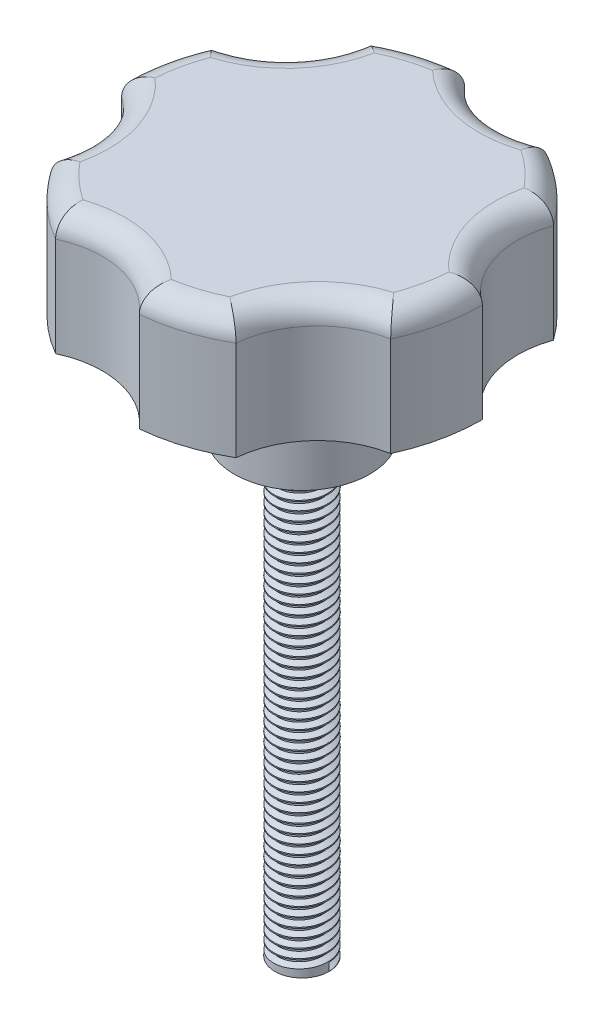
from build123d import *

# Parameters (mm, degrees)
SKETCH1_R           = 20
BOSS_EXTRUDE1_DEPTH = 13.5
CUT_EXTRUDE1_START  = -13.5
CUT_EXTRUDE1_DEPTH  = 13.5
CIRPATTERN1_COUNT   = 6
FILLET1_R           = 2.5
SKETCH4_R           = 7.5
BOSS_EXTRUDE2_DEPTH = 11.5
SKETCH5_R           = 3
BOSS_EXTRUDE3_DEPTH = 50
THREAD1_PITCH       = 1


with BuildPart() as part:
    # Sketch1 → Boss-Extrude1 (new body)
    with BuildSketch(Plane(origin=(0, 0, 0), x_dir=(1, 0, 0), z_dir=(0, 1, 0))):
        with Locations(Location((0, 0, 0), (0, 0, 270))):
            Circle(SKETCH1_R)
    extrude(amount=BOSS_EXTRUDE1_DEPTH)

    # Sketch2 → Cut-Extrude1 (cut)
    with BuildSketch(Plane(origin=(0, 13.5, 0), x_dir=(1, 0, 0), z_dir=(0, 1, 0)).offset(CUT_EXTRUDE1_START)):
        with BuildLine():
            ThreePointArc((16.311419753, 11.573140699), (16.197222222, 5.162363052), (20, 0))
            ThreePointArc((20, 0), (19.055555556, 6.073368297), (16.311419753, 11.573140699))
        make_face()
    cut_extrude1 = extrude(amount=CUT_EXTRUDE1_DEPTH, mode=Mode.SUBTRACT)

    # CirPattern1: Cut-Extrude1 ×6 about axis
    cirpattern1_axis = Axis((0, 0, 0), (0, 1, 0))
    for i in range(1, CIRPATTERN1_COUNT):
        add(cut_extrude1.rotate(cirpattern1_axis, i * 360 / CIRPATTERN1_COUNT), mode=Mode.SUBTRACT)

    # Fillet1
    fillet1_edges = [part.edges().sort_by_distance(p)[0] for p in [
        (19.539279343, 13.5, 4.268086546),
        (12.569348658, 13.5, 11.446024389),
        (-6.073368297, 13.5, -19.055555556),
        (-19.539279343, 13.5, -4.268086546),
        (-13.465911046, 13.5, 14.787469009),
        (6.073368297, 13.5, 19.055555556),
        (-3.627873564, 13.5, 16.608387441),
        (-16.197222222, 13.5, 5.162363052),
        (-12.569348658, 13.5, -11.446024389),
        (3.627873564, 13.5, -16.608387441),
        (13.465911046, 13.5, -14.787469009),
        (16.197222222, 13.5, -5.162363052),
    ]]
    fillet(fillet1_edges, radius=FILLET1_R)

    # Sketch4 → Boss-Extrude2 (add)
    with BuildSketch(Plane.XZ):
        with Locations(Location((0, 0, 0), (0, 0, 90))):
            Circle(SKETCH4_R)
    extrude(amount=BOSS_EXTRUDE2_DEPTH)

    # Sketch5 → Boss-Extrude3 (add)
    with BuildSketch(Plane.XZ.offset(11.5)):
        with Locations(Location((0, 0, 0), (0, 0, 270))):
            Circle(SKETCH5_R)
    extrude(amount=BOSS_EXTRUDE3_DEPTH)

    # Thread1: arcs per turn and ends read off the stored shape
    # Thread1: the profile of Thread Profile1 profile screwed along a right-hand helix through 50 turns, 8 arcs to a turn; built about Z, then put on its axis
    thread1_z = Axis((0, 0, 0), (0, 0, 1))
    thread1_corners = [(3.0003, 0, -0.000173205), (3.0003, 0, 0.875173202), (2.458734125, 0, 0.562499999), (2.458734125, 0, 0.312499999)]
    with BuildLine(mode=Mode.PRIVATE) as thread1_profile:
        Line(thread1_corners[0], thread1_corners[1])
        Line(thread1_corners[1], thread1_corners[2])
        Line(thread1_corners[2], thread1_corners[3])
        Line(thread1_corners[3], thread1_corners[0])
    thread1_cap = Face(thread1_profile.wire())
    thread1_turn_angles = [0, 22.5, 45, 67.5, 90, 112.5, 135, 157.5, 180, 202.5, 225, 247.5, 270, 292.5, 315, 337.5, 360]
    thread1_turn_weights = [1, 0.9238795325112867, 1, 0.9238795325112867, 1, 0.9238795325112867, 1, 0.9238795325112867, 1, 0.9238795325112867, 1, 0.9238795325112867, 1, 0.9238795325112867, 1, 0.9238795325112867, 1]
    thread1_turn_rails = [Edge.make_bspline([Vector(p[0], p[1], 0).rotate(thread1_z, thread1_turn_angles[k]) / thread1_turn_weights[k] + Vector(0, 0, p[2] + THREAD1_PITCH * thread1_turn_angles[k] / 360) for k in range(17)], [0, 0, 0, 1, 1, 2, 2, 3, 3, 4, 4, 5, 5, 6, 6, 7, 7, 8, 8, 8], 2, thread1_turn_weights) for p in thread1_corners]
    thread1_turn_sides = [Face.make_surface_from_curves(thread1_turn_rails[p[0]], thread1_turn_rails[p[1]]) for p in [(0, 1), (1, 2), (2, 3), (3, 0)]]
    thread1 = Plane(origin=(0, -61.5, 0), x_dir=(1, 0, 0), z_dir=(0, 1, 0)) * Solid(Shell([*[p.moved(Location((0, 0, THREAD1_PITCH * i))) for i in range(50) for p in thread1_turn_sides], thread1_cap, thread1_cap.rotate(thread1_z, 18000).moved(Location((0, 0, THREAD1_PITCH * 18000 / 360)))]))
    add(thread1, mode=Mode.SUBTRACT)


solid = part.part
